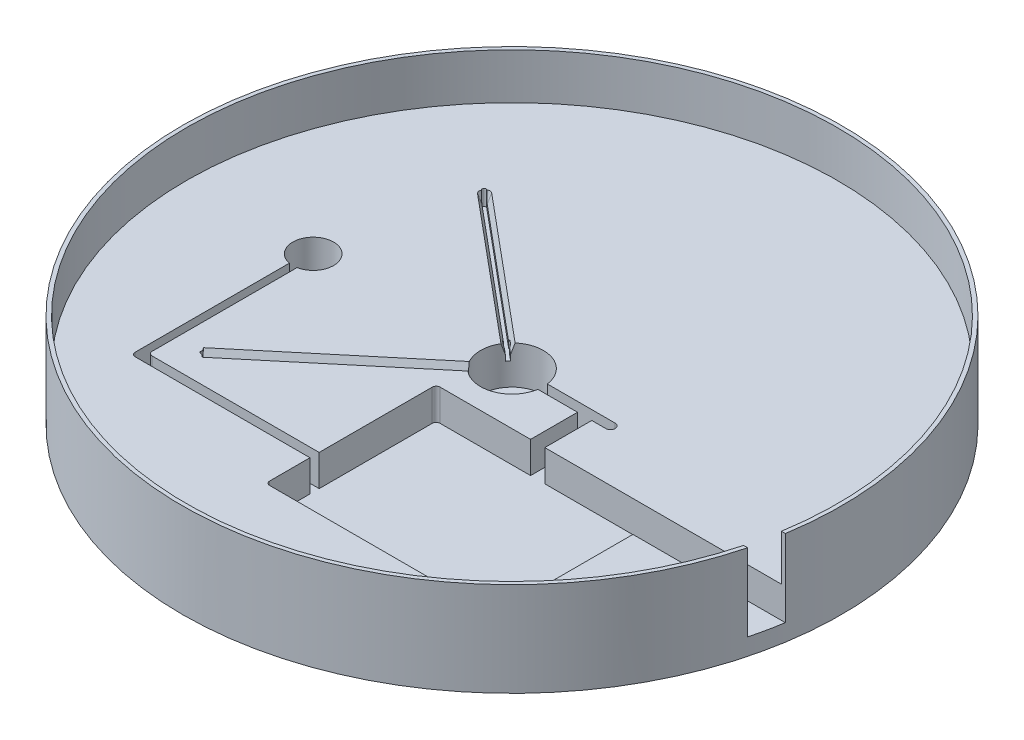
from build123d import *

# Parameters (mm, degrees)
SKETCH1_R                = 266.7
BOSS_EXTRUDE1_DEPTH      = 76.2
SKETCH2_R                = 263.525
CUT_EXTRUDE1_DEPTH       = 37.084
SKETCH3_R                = 25.4
CUT_EXTRUDE2_DEPTH       = 30.988
CUT_EXTRUDE3_DEPTH       = 380.193672753
CUT_EXTRUDE4_DEPTH       = 12.7
CUT_EXTRUDE5_DEPTH       = 6.35
CUT_EXTRUDE5_DEPTH_BACK  = 152.4
CUT_EXTRUDE6_DEPTH       = 152.4
CUT_EXTRUDE6_DEPTH_BACK  = 6.35
SKETCH12_W               = 4.318
SKETCH12_H               = 15.080276974
CUT_EXTRUDE10_DEPTH      = 6.35
SKETCH14_W               = 4.318
SKETCH14_H               = 12.7
CUT_EXTRUDE11_DEPTH      = 6.35
CUT_EXTRUDE12_DEPTH      = 27.94
FILLET3_R                = 3.175
FILLET4_R                = 3.175
FILLET5_R                = 3.175
FILLET6_R                = 3.175
CUT_EXTRUDE13_DEPTH      = 380.193672753
CUT_EXTRUDE13_DEPTH_BACK = 25.4
FILLET8_R                = 3.175


with BuildPart() as part:
    # Sketch1 → Boss-Extrude1 (new body)
    with BuildSketch(Plane(origin=(0, 0, 0), x_dir=(1, 0, 0), z_dir=(0, 1, 0))):
        with Locations(Location((0, 0, 0), (0, 0, 90))):
            Circle(SKETCH1_R)
    extrude(amount=BOSS_EXTRUDE1_DEPTH)

    # Sketch2 → Cut-Extrude1 (cut)
    with BuildSketch(Plane(origin=(0, 76.2, 0), x_dir=(1, 0, 0), z_dir=(0, 1, 0))):
        with Locations(Location((0, 0, 0), (0, 0, 270))):
            Circle(SKETCH2_R)
    extrude(amount=-CUT_EXTRUDE1_DEPTH, mode=Mode.SUBTRACT)

    # Sketch3 → Cut-Extrude2 (cut)
    with BuildSketch(Plane(origin=(0, 39.116, 0), x_dir=(1, 0, 0), z_dir=(0, 1, 0))):
        with Locations(Location((0, 0, 0), (0, 0, 270))):
            Circle(SKETCH3_R)
    extrude(amount=-CUT_EXTRUDE2_DEPTH, mode=Mode.SUBTRACT)

    # Sketch4 → Cut-Extrude3 (cut, through all)
    with BuildSketch(Plane(origin=(0, 39.116, 0), x_dir=(1, 0, 0), z_dir=(0, 1, 0))):
        with BuildLine():
            Line((3.81, 3.511669421), (80.01, 3.511669421))
            ThreePointArc((80.01, 3.511669421), (83.82, -0.298330579), (80.01, -4.108330579))
            Line((80.01, -4.108330579), (3.81, -4.108330579))
            ThreePointArc((3.81, -4.108330579), (0, -0.298330579), (3.81, 3.511669421))
        make_face()
    extrude(amount=-CUT_EXTRUDE3_DEPTH, mode=Mode.SUBTRACT)

    # Sketch5 → Cut-Extrude4 (cut)
    with BuildSketch(Plane(origin=(0, 39.116, 0), x_dir=(1, 0, 0), z_dir=(0, 1, 0))):
        with BuildLine():
            ThreePointArc((-18.489457636, -17.415509074), (-19.50107715, -16.274765436), (-20.442429489, -15.075379816))
            Line((-20.442429489, -15.075379816), (-137.484025976, -112.753293422))
            ThreePointArc((-137.484025976, -112.753293422), (-137.677604679, -114.899843977), (-135.531054124, -115.09342268))
            Line((-135.531054124, -115.09342268), (-18.489457636, -17.415509074))
        make_face()
        with BuildLine():
            Line((-0.976485926, -1.170064629), (-137.484025976, 112.753293422))
            ThreePointArc((-137.484025976, 112.753293422), (-137.677604679, 114.899843977), (-135.531054124, 115.09342268))
            Line((-135.531054124, 115.09342268), (0.976485926, 1.170064629))
            ThreePointArc((0.976485926, 1.170064629), (1.170064629, -0.976485926), (-0.976485926, -1.170064629))
        make_face()
    extrude(amount=-CUT_EXTRUDE4_DEPTH, mode=Mode.SUBTRACT)

    # Sketch6 → Cut-Extrude5 (cut, two sides: drawn at the far end of the back side and taken through both)
    with BuildSketch(Plane(origin=(-19.465943562, 0, -16.245444445), x_dir=(0.6407387966858445, 0, -0.7677589429121461), z_dir=(0.7677589429121461, 0, 0.6407387966858445)).offset(-CUT_EXTRUDE5_DEPTH_BACK)):
        Polygon((0, 26.416), (-4.067147417, 39.116), (4.067147417, 39.116), align=None)
    extrude(amount=CUT_EXTRUDE5_DEPTH + CUT_EXTRUDE5_DEPTH_BACK, mode=Mode.SUBTRACT)

    # Sketch11 → Cut-Extrude6 (cut, two sides: drawn at the far end of the back side and taken through both)
    with BuildSketch(Plane(origin=(-19.465943562, 0, 16.245444445), x_dir=(0.6407387966858473, 0, 0.7677589429121437), z_dir=(-0.7677589429121437, 0, 0.6407387966858473)).offset(-CUT_EXTRUDE6_DEPTH_BACK)):
        Polygon((0, 26.416), (4.751467106, 39.116), (-4.751467106, 39.116), align=None)
    extrude(amount=CUT_EXTRUDE6_DEPTH + CUT_EXTRUDE6_DEPTH_BACK, mode=Mode.SUBTRACT)

    # Sketch12 → Cut-Extrude10 (cut)
    with BuildSketch(Plane(origin=(-24.34121285, 0, 20.314135804), x_dir=(0.6407387966858473, 0, 0.7677589429121437), z_dir=(-0.7677589429121437, 0, 0.6407387966858473))):
        with Locations((0, 33.956138487)):
            Rectangle(SKETCH12_W, SKETCH12_H)
    extrude(amount=CUT_EXTRUDE10_DEPTH, mode=Mode.SUBTRACT)

    # Sketch14 → Cut-Extrude11 (cut)
    with BuildSketch(Plane(origin=(-24.34121285, 0, -20.314135804), x_dir=(0.6407387966858445, 0, -0.7677589429121461), z_dir=(0.7677589429121461, 0, 0.6407387966858445))):
        with Locations((0, 32.766)):
            Rectangle(SKETCH14_W, SKETCH14_H)
    extrude(amount=-CUT_EXTRUDE11_DEPTH, mode=Mode.SUBTRACT)

    # Sketch15 → Cut-Extrude12 (cut)
    with BuildSketch(Plane(origin=(0, 39.116, 0), x_dir=(1, 0, 0), z_dir=(0, 1, 0))):
        with BuildLine():
            Line((-163.944291355, -16.219005523), (-163.944291355, -18.54493052))
            Line((-163.944291355, -18.54493052), (-157.772108645, -18.54493052))
            Line((-157.772108645, -18.54493052), (-157.772108645, -16.219005523))
            ThreePointArc((-157.772108645, -16.219005523), (-160.8582, 16.51), (-163.944291355, -16.219005523))
        make_face()
    extrude(amount=-CUT_EXTRUDE12_DEPTH, mode=Mode.SUBTRACT)

    # Fillet3
    # the kernel refuses this fillet: 3.175 mm, written as the material it adds along each edge
    with BuildSketch(Plane(origin=(-22.957857788, 37.920153839, -21.971727362), x_dir=(-0.7677589429121467, 0, -0.6407387966858438), z_dir=(0, -1, 0))) as fillet3_piece_1_section:
        with BuildLine():
            CenterArc((1.905, -3.175), FILLET3_R, 90, 36.869897646)
            Line((0, -0.635), (-0.0381, -0.5842))
            ThreePointArc((-0.0381, -0.5842), (-0.0635, -0.3175), (-0.0635, 0))
            Line((-0.0635, 0), (0, 0.0635))
            Line((0, 0.0635), (1.905, 0.0635))
            Line((1.905, 0.0635), (1.905, 0))
        make_face()
    fillet3_piece_1 = extrude(amount=16.266653839, mode=Mode.PRIVATE)
    fillet3_piece_1 = split(fillet3_piece_1, bisect_by=Plane(origin=(-24.062062875, 29.877521432, -21.52503997), z_dir=(0.6102111889180302, -0.3049898163702348, -0.731179538027217)), keep=Keep.TOP, mode=Mode.PRIVATE)
    add(fillet3_piece_1)

    # Fillet4
    # the kernel refuses this fillet: 3.175 mm, written as the material it adds along each edge
    with BuildSketch(Plane(origin=(-27.833127075, 21.6535, 26.040418721), x_dir=(-0.640738796685741, 0, -0.7677589429122325), z_dir=(0, 1, 0))) as fillet4_piece_1_section:
        with BuildLine():
            CenterArc((3.175, -1.905), FILLET4_R, 143.130102354, 36.869897646)
            Line((0, -1.905), (-0.0635, -1.905))
            Line((-0.0635, -1.905), (-0.0635, 0))
            Line((-0.0635, 0), (0, 0.0635))
            ThreePointArc((0, 0.0635), (0.3175, 0.0635), (0.5842, 0.0381))
            Line((0.5842, 0.0381), (0.635, 0))
        make_face()
    fillet4_piece_1 = extrude(amount=15.295701846, mode=Mode.PRIVATE)
    fillet4_piece_1 = split(fillet4_piece_1, bisect_by=Plane(origin=(-29.144428623, 24.988566888, 23.627101883), z_dir=(0.6001136551613587, -0.35041000177300097, 0.7190802678048671)), keep=Keep.TOP, mode=Mode.PRIVATE)
    add(fillet4_piece_1)
    with BuildSketch(Plane(origin=(-30.599837199, 36.949201846, 22.725235606), x_dir=(0.7677589429121437, 0, -0.6407387966858474), z_dir=(0, -1, 0))) as fillet4_piece_2_section:
        with BuildLine():
            CenterArc((1.905, 3.175), FILLET4_R, 233.130102354, 36.869897646)
            Line((0, 0.635), (-0.0381, 0.5842))
            ThreePointArc((-0.0381, 0.5842), (-0.0635, 0.3175), (-0.0635, 0))
            Line((-0.0635, 0), (0, -0.0635))
            Line((0, -0.0635), (1.905, -0.0635))
            Line((1.905, -0.0635), (1.905, 0))
        make_face()
    fillet4_piece_2 = extrude(amount=15.295701846, mode=Mode.PRIVATE)
    fillet4_piece_2 = split(fillet4_piece_2, bisect_by=Plane(origin=(-29.514976804, 29.459680247, 23.148743411), z_dir=(-0.6001136551613584, -0.3504100017730014, -0.7190802678048671)), keep=Keep.TOP, mode=Mode.PRIVATE)
    add(fillet4_piece_2)
    with BuildSketch(Plane(origin=(-25.724567912, 36.949201846, 18.656544247), x_dir=(0.6407387966857708, 0, 0.7677589429122077), z_dir=(0, -1, 0))) as fillet4_piece_3_section:
        with BuildLine():
            CenterArc((3.175, 1.905), FILLET4_R, 180, 36.869897646)
            Line((0, 1.905), (-0.0635, 1.905))
            Line((-0.0635, 1.905), (-0.0635, 0))
            Line((-0.0635, 0), (0, -0.0635))
            ThreePointArc((0, -0.0635), (0.3175, -0.0635), (0.5842, -0.0381))
            Line((0.5842, -0.0381), (0.635, 0))
        make_face()
    fillet4_piece_3 = extrude(amount=15.295701846, mode=Mode.PRIVATE)
    fillet4_piece_3 = split(fillet4_piece_3, bisect_by=Plane(origin=(-25.501982789, 29.459680247, 19.799670137), z_dir=(-0.6001136551613584, -0.3504100017730014, -0.7190802678048671)), keep=Keep.TOP, mode=Mode.PRIVATE)
    add(fillet4_piece_3)
    with BuildSketch(Plane(origin=(-22.957857788, 21.6535, 21.971727362), x_dir=(-0.767758942912144, 0, 0.640738796685847), z_dir=(0, 1, 0))) as fillet4_piece_4_section:
        with BuildLine():
            CenterArc((1.905, -3.175), FILLET4_R, 90, 36.869897646)
            Line((0, -0.635), (-0.0381, -0.5842))
            ThreePointArc((-0.0381, -0.5842), (-0.0635, -0.3175), (-0.0635, 0))
            Line((-0.0635, 0), (0, 0.0635))
            Line((0, 0.0635), (1.905, 0.0635))
            Line((1.905, 0.0635), (1.905, 0))
        make_face()
    fillet4_piece_4 = extrude(amount=15.295701846, mode=Mode.PRIVATE)
    fillet4_piece_4 = split(fillet4_piece_4, bisect_by=Plane(origin=(-25.09763609, 24.988566888, 20.249821811), z_dir=(0.6001136551613587, -0.35041000177300097, 0.7190802678048671)), keep=Keep.TOP, mode=Mode.PRIVATE)
    add(fillet4_piece_4)
    with BuildSketch(Plane(origin=(-30.599837199, 21.6535, -22.725235606), x_dir=(0.6407387966859301, 0, -0.7677589429120746), z_dir=(0, 1, 0))) as fillet4_piece_5_section:
        with BuildLine():
            CenterArc((3.175, -1.905), FILLET4_R, 143.130102354, 36.869897646)
            Line((0, -1.905), (-0.0635, -1.905))
            Line((-0.0635, -1.905), (-0.0635, 0))
            Line((-0.0635, 0), (0, 0.0635))
            ThreePointArc((0, 0.0635), (0.3175, 0.0635), (0.5842, 0.0381))
            Line((0.5842, 0.0381), (0.635, 0))
        make_face()
    fillet4_piece_5 = extrude(amount=16.266653839, mode=Mode.PRIVATE)
    fillet4_piece_5 = split(fillet4_piece_5, bisect_by=Plane(origin=(-28.479191191, 24.841632974, -24.424216075), z_dir=(-0.6102111889180335, -0.30498981637021927, 0.7311795380272208)), keep=Keep.TOP, mode=Mode.PRIVATE)
    add(fillet4_piece_5)
    with BuildSketch(Plane(origin=(-27.833127075, 37.920153839, -26.040418721), x_dir=(0.767758942912146, 0, 0.6407387966858447), z_dir=(0, -1, 0))) as fillet4_piece_6_section:
        with BuildLine():
            CenterArc((1.905, 3.175), FILLET4_R, 233.130102354, 36.869897646)
            Line((0, 0.635), (-0.0381, 0.5842))
            ThreePointArc((-0.0381, 0.5842), (-0.0635, 0.3175), (-0.0635, 0))
            Line((-0.0635, 0), (0, -0.0635))
            Line((0, -0.0635), (1.905, -0.0635))
            Line((1.905, -0.0635), (1.905, 0))
        make_face()
    fillet4_piece_6 = extrude(amount=16.266653839, mode=Mode.PRIVATE)
    fillet4_piece_6 = split(fillet4_piece_6, bisect_by=Plane(origin=(-28.075056891, 29.877521432, -24.874113244), z_dir=(0.6102111889181517, -0.30498981637007594, -0.731179538027182)), keep=Keep.TOP, mode=Mode.PRIVATE)
    add(fillet4_piece_6)
    with BuildSketch(Plane(origin=(-25.724567912, 21.6535, -18.656544247), x_dir=(-0.7677589429121459, 0, -0.6407387966858448), z_dir=(0, 1, 0))) as fillet4_piece_7_section:
        with BuildLine():
            CenterArc((1.905, -3.175), FILLET4_R, 90, 36.869897646)
            Line((0, -0.635), (-0.0381, -0.5842))
            ThreePointArc((-0.0381, -0.5842), (-0.0635, -0.3175), (-0.0635, 0))
            Line((-0.0635, 0), (0, 0.0635))
            Line((0, 0.0635), (1.905, 0.0635))
            Line((1.905, 0.0635), (1.905, 0))
        make_face()
    fillet4_piece_7 = extrude(amount=16.266653839, mode=Mode.PRIVATE)
    fillet4_piece_7 = split(fillet4_piece_7, bisect_by=Plane(origin=(-24.432398658, 24.841632974, -21.046936002), z_dir=(-0.6102111889180335, -0.30498981637021927, 0.7311795380272208)), keep=Keep.TOP, mode=Mode.PRIVATE)
    add(fillet4_piece_7)

    # Fillet5
    # the kernel refuses this fillet: 3.175 mm, written as the material it adds along each edge
    with BuildSketch(Plane(origin=(-132.315290532, 46.675322671, -118.875260218), x_dir=(0.7677589429120775, 3.430744963368742e-14, 0.6407387966859268), z_dir=(-0.19541880794250094, -0.9523556121063447, 0.23415865901538102))) as fillet5_piece_1_section:
        with BuildLine():
            CenterArc((FILLET5_R, FILLET5_R), FILLET5_R, 180, 90)
            Line((0, FILLET5_R), (0, 0))
            Line((0, 0), (FILLET5_R, 0))
        make_face()
    fillet5_piece_1 = extrude(amount=24.213466665, mode=Mode.PRIVATE)
    fillet5_piece_1 = split(fillet5_piece_1, bisect_by=Plane(origin=(-134.161464886, 39.116, -115.294765638), z_dir=(0, -1, 0)), keep=Keep.TOP, mode=Mode.PRIVATE)
    fillet5_piece_1 = split(fillet5_piece_1, bisect_by=Plane(origin=(-134.822791784, 35.893084099, -114.502337205), z_dir=(0.6407387966858452, 0, -0.7677589429121455)), keep=Keep.TOP, mode=Mode.PRIVATE)
    add(fillet5_piece_1)
    with BuildSketch(Plane(origin=(-132.315290532, 46.675322671, -118.875260218), x_dir=(0.7677589429120775, 3.430744963368742e-14, 0.6407387966859268), z_dir=(-0.19541880794250094, -0.9523556121063447, 0.23415865901538102))) as fillet5_piece_2_section:
        with BuildLine():
            CenterArc((FILLET5_R, FILLET5_R), FILLET5_R, 180, 90)
            Line((0, FILLET5_R), (0, 0))
            Line((0, 0), (FILLET5_R, 0))
        make_face()
    fillet5_piece_2 = extrude(amount=24.213466665, mode=Mode.PRIVATE)
    fillet5_piece_2 = split(fillet5_piece_2, bisect_by=Plane(origin=(-137.32634275, 25.904168976, -112.621697741), z_dir=(-0.640738796685845, 0, 0.7677589429121457)), keep=Keep.TOP, mode=Mode.PRIVATE)
    add(fillet5_piece_2)
    with BuildSketch(Plane(origin=(-135.8977556, 23.615491804, -114.582606787), x_dir=(0.7677589429121472, 0, 0.6407387966858433), z_dir=(-0.19541880794249095, 0.9523556121063497, 0.23415865901536906))) as fillet5_piece_3_section:
        with BuildLine():
            CenterArc((FILLET5_R, FILLET5_R), FILLET5_R, 180, 90)
            Line((0, FILLET5_R), (0, 0))
            Line((0, 0), (FILLET5_R, 0))
        make_face()
    fillet5_piece_3 = extrude(amount=24.213466665, mode=Mode.PRIVATE)
    fillet5_piece_3 = split(fillet5_piece_3, bisect_by=Plane(origin=(-135.373370898, 25.904168977, -114.961826999), z_dir=(0.6407387966858452, 0, -0.7677589429121455)), keep=Keep.TOP, mode=Mode.PRIVATE)
    add(fillet5_piece_3)
    with BuildSketch(Plane(origin=(-135.8977556, 23.615491804, -114.582606787), x_dir=(0.7677589429121472, 0, 0.6407387966858433), z_dir=(-0.19541880794249095, 0.9523556121063497, 0.23415865901536906))) as fillet5_piece_4_section:
        with BuildLine():
            CenterArc((FILLET5_R, FILLET5_R), FILLET5_R, 180, 90)
            Line((0, FILLET5_R), (0, 0))
            Line((0, 0), (FILLET5_R, 0))
        make_face()
    fillet5_piece_4 = extrude(amount=24.213466665, mode=Mode.PRIVATE)
    fillet5_piece_4 = split(fillet5_piece_4, bisect_by=Plane(origin=(-137.437090535, 39.116, -111.369779514), z_dir=(0, -1, 0)), keep=Keep.TOP, mode=Mode.PRIVATE)
    fillet5_piece_4 = split(fillet5_piece_4, bisect_by=Plane(origin=(-136.775763636, 35.893084099, -112.162207947), z_dir=(-0.640738796685845, 0, 0.7677589429121457)), keep=Keep.TOP, mode=Mode.PRIVATE)
    add(fillet5_piece_4)

    # Fillet6
    # the kernel refuses this fillet: 3.175 mm, written as the material it takes off along each edge
    with BuildSketch(Plane(origin=(-135.495920536, 44.069726972, 115.064101689), x_dir=(-0.9408962833877623, 0, 0.3386948241516185), z_dir=(0, -1, 0))) as fillet6_piece_1_section:
        with BuildLine():
            CenterArc((2.303263748, -2.949899465), FILLET6_R, 111.704706858, 48.245736997)
            Line((-0.67931998, -1.861405413), (-0.977578353, -1.752556008))
            Line((-0.977578353, -1.752556008), (-0.298258373, 0.108849405))
            Line((-0.298258373, 0.108849405), (0.108849405, 0.298258373))
            ThreePointArc((0.108849405, 0.298258373), (0.151837335, 0.282569926), (1.011656626, 0.294989946))
            Line((1.011656626, 0.294989946), (1.129075455, 0))
        make_face()
    fillet6_piece_1 = extrude(amount=18.534017348, mode=Mode.PRIVATE)
    fillet6_piece_1 = split(fillet6_piece_1, bisect_by=Plane(origin=(-134.042471425, 37.040108879, 117.043277716), z_dir=(-0.6001136551613587, 0.3504100017730009, -0.7190802678048671)), keep=Keep.TOP, mode=Mode.PRIVATE)
    add(fillet6_piece_1, mode=Mode.SUBTRACT)
    with BuildSketch(Plane(origin=(-137.448892388, 25.535709624, 112.723972431), x_dir=(-0.6407387966858429, 0, -0.7677589429121475), z_dir=(0, 1, 0))) as fillet6_piece_2_section:
        with BuildLine():
            CenterArc((1.981490789, 3.175), FILLET6_R, 221.754263003, 48.245736997)
            Line((-0.387084068, 1.060649474), (-0.623941554, 0.849214422))
            ThreePointArc((-0.623941554, 0.849214422), (-0.3175, 0.045761222), (-0.3175, 0))
            Line((-0.3175, 0), (0, -0.3175))
            Line((0, -0.3175), (1.981490789, -0.3175))
            Line((1.981490789, -0.3175), (1.981490789, 0))
        make_face()
    fillet6_piece_2 = extrude(amount=18.534017348, mode=Mode.PRIVATE)
    fillet6_piece_2 = split(fillet6_piece_2, bisect_by=Plane(origin=(-139.136103081, 37.040108879, 110.939883828), z_dir=(0.6001136551610721, 0.3504100017730421, 0.7190802678050863)), keep=Keep.TOP, mode=Mode.PRIVATE)
    add(fillet6_piece_2, mode=Mode.SUBTRACT)

    # Sketch18 → Cut-Extrude13 (cut, two sides: drawn at the far end of the back side and taken through both)
    with BuildSketch(Plane(origin=(0, 39.116, 0), x_dir=(1, 0, 0), z_dir=(0, 1, 0)).offset(-CUT_EXTRUDE13_DEPTH_BACK)):
        Polygon((-19.238275413, -180.045164459), (165.198234521, -180.045164459), (165.198234521, -67.325222668), (267.08562237, -67.325222668), (267.08562237, -42.109873745), (165.198234521, -42.109873745), (68.68395137, -42.109873745), (68.68395137, -4.108330579), (57.159387951, -4.108330579), (57.159387951, -42.109873745), (-19.238275413, -42.109873745), (-19.238275413, -136.80596573), (-157.688900722, -136.80596573), (-157.688900722, -18.54493052), (-163.944291355, -18.54493052), (-163.944291355, -144.258110226), (-157.688900722, -144.258110226), (-19.238275413, -144.258110226), align=None)
    extrude(amount=CUT_EXTRUDE13_DEPTH + CUT_EXTRUDE13_DEPTH_BACK, mode=Mode.SUBTRACT)

    # Fillet8
    fillet8_edges = [part.edges().sort_by_distance(p)[0] for p in [
        (-19.238275413, 26.416, 180.045164459),
        (165.198234521, 26.416, 180.045164459),
        (-19.238275413, 26.416, 42.109873745),
        (-157.688900722, 26.416, 136.80596573),
        (-163.944291355, 26.416, 144.258110226),
    ]]
    fillet(fillet8_edges, radius=FILLET8_R)


solid = part.part
